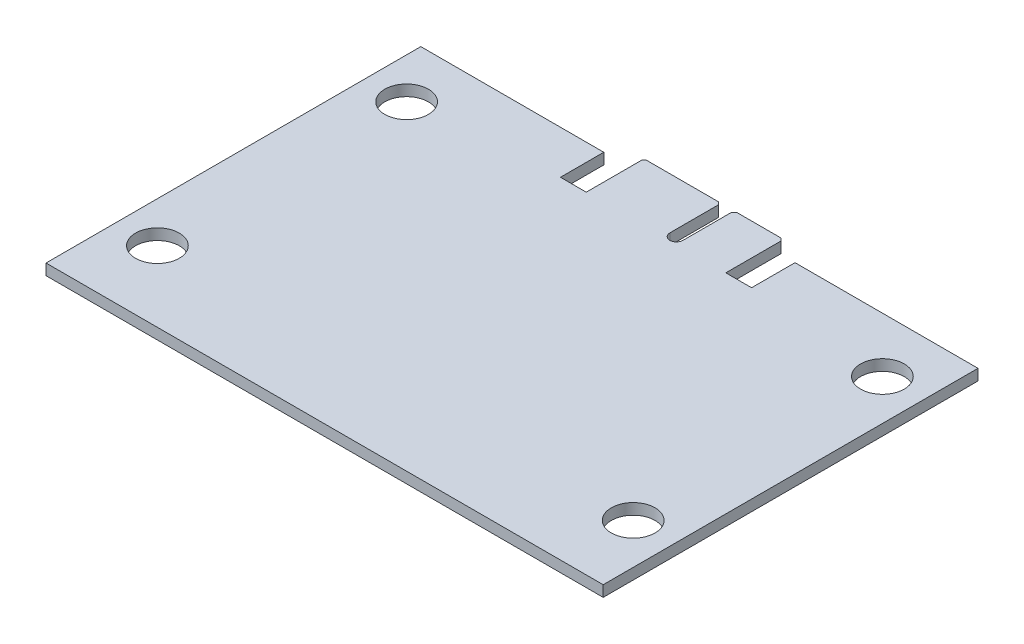
from build123d import *

# Parameters (mm, degrees)
BOSS_EXTRUDE1_DEPTH      = 0.8
BOSS_EXTRUDE1_DEPTH_BACK = 0.8
SKETCH1_R                = 3.175


with BuildPart() as part:
    # Sketch1 → Boss-Extrude1 (new, two sides: drawn at the far end of the back side and taken through both)
    with BuildSketch(Plane(origin=(0, -3.67150551, 0.252), x_dir=(1, 0, 0), z_dir=(0, 1, 0)).offset(-BOSS_EXTRUDE1_DEPTH_BACK)):
        with BuildLine():
            Line((18.139517971, -14.21299157), (14.389517971, -14.21299157))
            Line((14.389517971, -14.21299157), (14.389517971, -7.91299157))
            Line((14.389517971, -7.91299157), (-12.210526677, -7.91299157))
            Line((-12.210526677, -7.91299157), (-12.210526677, -62.398481807))
            Line((-12.210526677, -62.398481807), (68.789473323, -62.398481807))
            Line((68.789473323, -62.398481807), (68.789473323, -7.91299157))
            Line((68.789473323, -7.91299157), (42.189428676, -7.91299157))
            Line((42.189428676, -7.91299157), (42.189428676, -14.22599157))
            Line((42.189428676, -14.22599157), (38.439428676, -14.22599157))
            Line((38.439428676, -14.22599157), (38.439428676, -6.17999157))
            Line((38.439428676, -6.17999157), (38.085428676, -5.82599157))
            Line((38.085428676, -5.82599157), (31.593428676, -5.82599157))
            Line((31.593428676, -5.82599157), (31.239428676, -6.17999157))
            Line((31.239428676, -6.17999157), (31.239428676, -13.26299157))
            ThreePointArc((31.239428676, -13.26299157), (30.289473323, -14.2000108), (29.339517971, -13.26299157))
            Line((29.339517971, -13.26299157), (29.339517971, -6.16699157))
            Line((29.339517971, -6.16699157), (28.984517971, -5.81299157))
            Line((28.984517971, -5.81299157), (18.494517971, -5.81299157))
            Line((18.494517971, -5.81299157), (18.139517971, -6.16699157))
            Line((18.139517971, -6.16699157), (18.139517971, -14.21299157))
        make_face()
        with Locations((-6.293950804, -52.120337947)):
            Circle(SKETCH1_R, mode=Mode.SUBTRACT)
        with Locations((-6.293950804, -15.893644029)):
            Circle(SKETCH1_R, mode=Mode.SUBTRACT)
        with Locations((62.872897451, -52.120337947)):
            Circle(SKETCH1_R, mode=Mode.SUBTRACT)
        with Locations((62.872897451, -15.893644029)):
            Circle(SKETCH1_R, mode=Mode.SUBTRACT)
    extrude(amount=BOSS_EXTRUDE1_DEPTH + BOSS_EXTRUDE1_DEPTH_BACK)


solid = part.part
